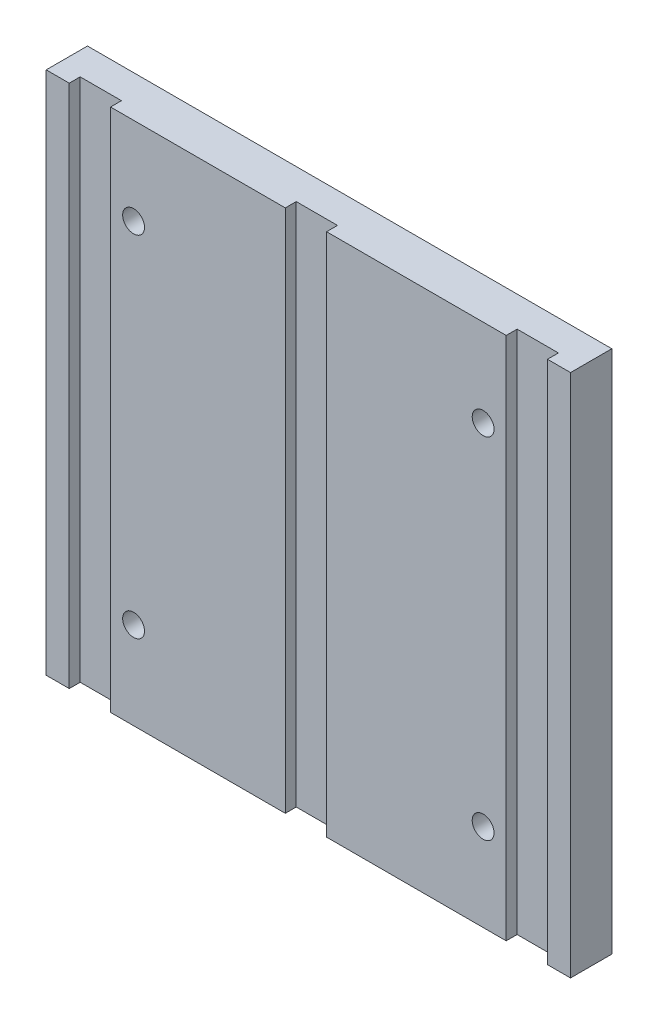
from build123d import *

# Parameters (mm, degrees)
SKETCH1_W           = 152.4
SKETCH1_H           = 152.4
SKETCH1_R           = 3.175
BOSS_EXTRUDE1_DEPTH = 12.0000014
SKETCH2_W           = 12.0000014
SKETCH2_H           = 152.4
CUT_EXTRUDE1_DEPTH  = 3.175


with BuildPart() as part:
    # Sketch1 → Boss-Extrude1 (new body)
    with BuildSketch(Plane.XY):
        Rectangle(SKETCH1_W, SKETCH1_H)
        with Locations((-50.8, 50.8)):
            Circle(SKETCH1_R, mode=Mode.SUBTRACT)
        with Locations((50.8, 50.8)):
            Circle(SKETCH1_R, mode=Mode.SUBTRACT)
        with Locations((50.8, -50.8)):
            Circle(SKETCH1_R, mode=Mode.SUBTRACT)
        with Locations((-50.8, -50.8)):
            Circle(SKETCH1_R, mode=Mode.SUBTRACT)
    extrude(amount=BOSS_EXTRUDE1_DEPTH)

    # Sketch2 → Cut-Extrude1 (cut)
    with BuildSketch(Plane.XY.offset(12.0000014)):
        with Locations((-63.5, 0)):
            Rectangle(SKETCH2_W, SKETCH2_H)
        with Locations((-0.6999986, 0)):
            Rectangle(SKETCH2_W, SKETCH2_H)
        with Locations((63.5, 0)):
            Rectangle(SKETCH2_W, SKETCH2_H)
    extrude(amount=-CUT_EXTRUDE1_DEPTH, mode=Mode.SUBTRACT)


solid = part.part
